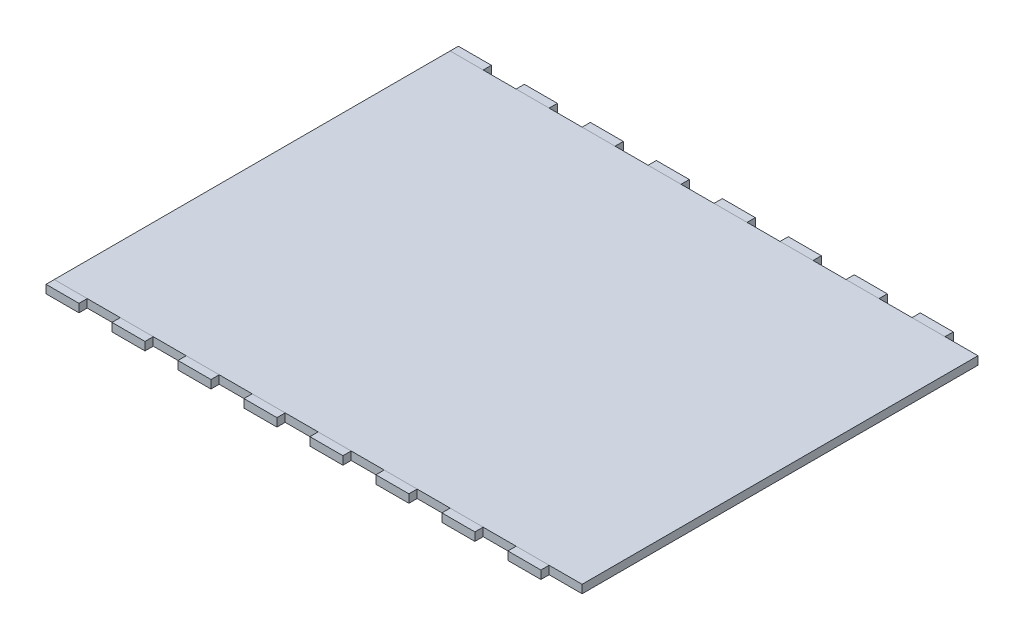
from build123d import *

# Parameters (mm, degrees)
SKETCH1_W              = 203.2
SKETCH1_H              = 152.4
BOSS_EXTRUDE1_DEPTH    = 3.175
SKETCH2_W              = 12.7
SKETCH2_H              = 3.175
BOSS_EXTRUDE2_DEPTH    = 3.175
BOSS_EXTRUDE2_2_DEPTH  = 3.175
BOSS_EXTRUDE2_3_DEPTH  = 3.175
BOSS_EXTRUDE2_4_DEPTH  = 3.175
BOSS_EXTRUDE2_5_DEPTH  = 3.175
BOSS_EXTRUDE2_6_DEPTH  = 3.175
BOSS_EXTRUDE2_7_DEPTH  = 3.175
BOSS_EXTRUDE2_8_DEPTH  = 3.175
BOSS_EXTRUDE2_9_DEPTH  = 3.175
BOSS_EXTRUDE2_10_DEPTH = 3.175
BOSS_EXTRUDE2_11_DEPTH = 3.175
BOSS_EXTRUDE2_12_DEPTH = 3.175
BOSS_EXTRUDE2_13_DEPTH = 3.175
BOSS_EXTRUDE2_14_DEPTH = 3.175
BOSS_EXTRUDE2_15_DEPTH = 3.175
BOSS_EXTRUDE2_16_DEPTH = 3.175


with BuildPart() as part:
    # Sketch1 → Boss-Extrude1 (new body)
    with BuildSketch(Plane(origin=(0, 0, 0), x_dir=(1, 0, 0), z_dir=(0, 1, 0))):
        with Locations((101.6, 76.2)):
            Rectangle(SKETCH1_W, SKETCH1_H)
    extrude(amount=BOSS_EXTRUDE1_DEPTH)


with BuildPart() as body_2:
    # Sketch2 → Boss-Extrude2 (new body)
    with BuildSketch(Plane(origin=(0, 3.175, 0), x_dir=(1, 0, 0), z_dir=(0, 1, 0))):
        with Locations((31.75, -1.5875)):
            Rectangle(SKETCH2_W, SKETCH2_H)
    extrude(amount=-BOSS_EXTRUDE2_DEPTH)


with BuildPart() as body_3:
    # Sketch2 → Boss-Extrude2 2 (new body)
    with BuildSketch(Plane(origin=(0, 3.175, 0), x_dir=(1, 0, 0), z_dir=(0, 1, 0))):
        with Locations((6.35, -1.5875)):
            Rectangle(SKETCH2_W, SKETCH2_H)
    extrude(amount=-BOSS_EXTRUDE2_2_DEPTH)


with BuildPart() as body_4:
    # Sketch2 → Boss-Extrude2 3 (new body)
    with BuildSketch(Plane(origin=(0, 3.175, 0), x_dir=(1, 0, 0), z_dir=(0, 1, 0))):
        with Locations((57.15, -1.5875)):
            Rectangle(SKETCH2_W, SKETCH2_H)
    extrude(amount=-BOSS_EXTRUDE2_3_DEPTH)


with BuildPart() as body_5:
    # Sketch2 → Boss-Extrude2 4 (new body)
    with BuildSketch(Plane(origin=(0, 3.175, 0), x_dir=(1, 0, 0), z_dir=(0, 1, 0))):
        with Locations((82.55, -1.5875)):
            Rectangle(SKETCH2_W, SKETCH2_H)
    extrude(amount=-BOSS_EXTRUDE2_4_DEPTH)


with BuildPart() as body_6:
    # Sketch2 → Boss-Extrude2 5 (new body)
    with BuildSketch(Plane(origin=(0, 3.175, 0), x_dir=(1, 0, 0), z_dir=(0, 1, 0))):
        with Locations((107.95, -1.5875)):
            Rectangle(SKETCH2_W, SKETCH2_H)
    extrude(amount=-BOSS_EXTRUDE2_5_DEPTH)


with BuildPart() as body_7:
    # Sketch2 → Boss-Extrude2 6 (new body)
    with BuildSketch(Plane(origin=(0, 3.175, 0), x_dir=(1, 0, 0), z_dir=(0, 1, 0))):
        with Locations((133.35, -1.5875)):
            Rectangle(SKETCH2_W, SKETCH2_H)
    extrude(amount=-BOSS_EXTRUDE2_6_DEPTH)


with BuildPart() as body_8:
    # Sketch2 → Boss-Extrude2 7 (new body)
    with BuildSketch(Plane(origin=(0, 3.175, 0), x_dir=(1, 0, 0), z_dir=(0, 1, 0))):
        with Locations((158.75, -1.5875)):
            Rectangle(SKETCH2_W, SKETCH2_H)
    extrude(amount=-BOSS_EXTRUDE2_7_DEPTH)


with BuildPart() as body_9:
    # Sketch2 → Boss-Extrude2 8 (new body)
    with BuildSketch(Plane(origin=(0, 3.175, 0), x_dir=(1, 0, 0), z_dir=(0, 1, 0))):
        with Locations((184.15, -1.5875)):
            Rectangle(SKETCH2_W, SKETCH2_H)
    extrude(amount=-BOSS_EXTRUDE2_8_DEPTH)


with BuildPart() as body_10:
    # Sketch2 → Boss-Extrude2 9 (new body)
    with BuildSketch(Plane(origin=(0, 3.175, 0), x_dir=(1, 0, 0), z_dir=(0, 1, 0))):
        with Locations((184.15, 153.9875)):
            Rectangle(SKETCH2_W, SKETCH2_H)
    extrude(amount=-BOSS_EXTRUDE2_9_DEPTH)


with BuildPart() as body_11:
    # Sketch2 → Boss-Extrude2 10 (new body)
    with BuildSketch(Plane(origin=(0, 3.175, 0), x_dir=(1, 0, 0), z_dir=(0, 1, 0))):
        with Locations((158.75, 153.9875)):
            Rectangle(SKETCH2_W, SKETCH2_H)
    extrude(amount=-BOSS_EXTRUDE2_10_DEPTH)


with BuildPart() as body_12:
    # Sketch2 → Boss-Extrude2 11 (new body)
    with BuildSketch(Plane(origin=(0, 3.175, 0), x_dir=(1, 0, 0), z_dir=(0, 1, 0))):
        with Locations((133.35, 153.9875)):
            Rectangle(SKETCH2_W, SKETCH2_H)
    extrude(amount=-BOSS_EXTRUDE2_11_DEPTH)


with BuildPart() as body_13:
    # Sketch2 → Boss-Extrude2 12 (new body)
    with BuildSketch(Plane(origin=(0, 3.175, 0), x_dir=(1, 0, 0), z_dir=(0, 1, 0))):
        with Locations((107.95, 153.9875)):
            Rectangle(SKETCH2_W, SKETCH2_H)
    extrude(amount=-BOSS_EXTRUDE2_12_DEPTH)


with BuildPart() as body_14:
    # Sketch2 → Boss-Extrude2 13 (new body)
    with BuildSketch(Plane(origin=(0, 3.175, 0), x_dir=(1, 0, 0), z_dir=(0, 1, 0))):
        with Locations((82.55, 153.9875)):
            Rectangle(SKETCH2_W, SKETCH2_H)
    extrude(amount=-BOSS_EXTRUDE2_13_DEPTH)


with BuildPart() as body_15:
    # Sketch2 → Boss-Extrude2 14 (new body)
    with BuildSketch(Plane(origin=(0, 3.175, 0), x_dir=(1, 0, 0), z_dir=(0, 1, 0))):
        with Locations((57.15, 153.9875)):
            Rectangle(SKETCH2_W, SKETCH2_H)
    extrude(amount=-BOSS_EXTRUDE2_14_DEPTH)


with BuildPart() as body_16:
    # Sketch2 → Boss-Extrude2 15 (new body)
    with BuildSketch(Plane(origin=(0, 3.175, 0), x_dir=(1, 0, 0), z_dir=(0, 1, 0))):
        with Locations((31.75, 153.9875)):
            Rectangle(SKETCH2_W, SKETCH2_H)
    extrude(amount=-BOSS_EXTRUDE2_15_DEPTH)


with BuildPart() as body_17:
    # Sketch2 → Boss-Extrude2 16 (new body)
    with BuildSketch(Plane(origin=(0, 3.175, 0), x_dir=(1, 0, 0), z_dir=(0, 1, 0))):
        with Locations((6.35, 153.9875)):
            Rectangle(SKETCH2_W, SKETCH2_H)
    extrude(amount=-BOSS_EXTRUDE2_16_DEPTH)


solid = Compound([part.part, body_2.part, body_3.part, body_4.part, body_5.part, body_6.part, body_7.part, body_8.part, body_9.part, body_10.part, body_11.part, body_12.part, body_13.part, body_14.part, body_15.part, body_16.part, body_17.part])
